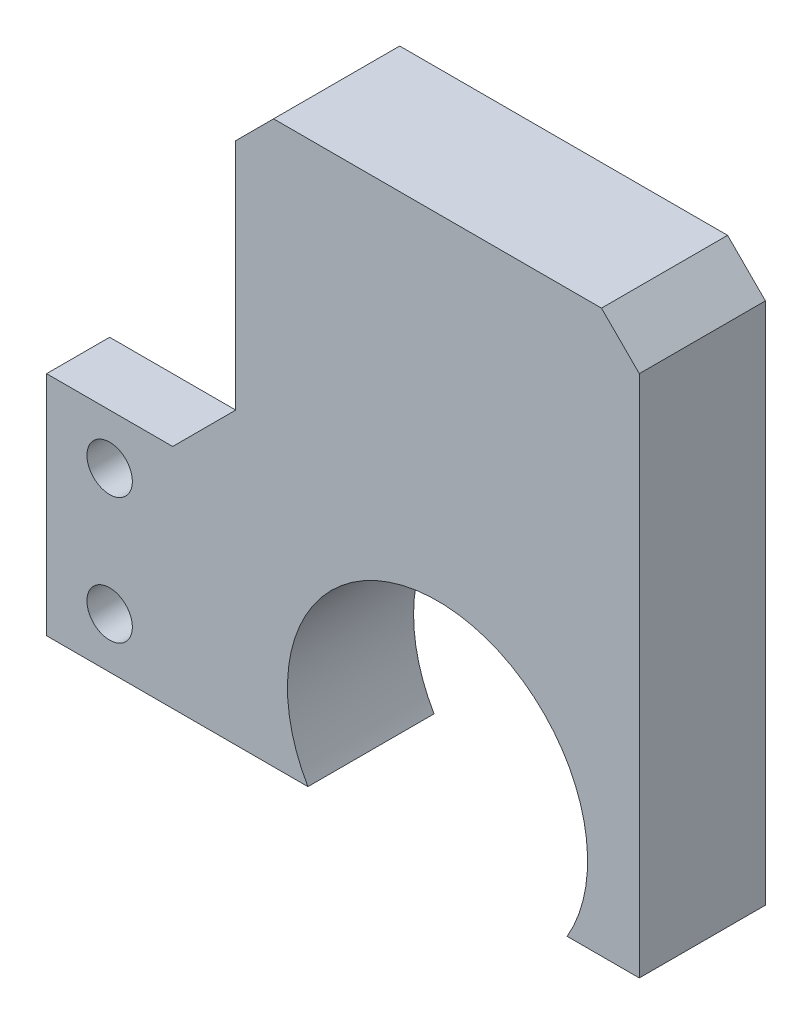
from build123d import *

# Parameters (mm, degrees)
SZKIC1_W                                          = 32
SZKIC1_H                                          = 44.5
DODANIE_WYCI_GNI_CIE1_DEPTH                       = 10
WYTNIJ_WYCI_GNI_CIE1_REACH                        = 31.173
SZKIC2_R                                          = 11.9
WYTNIJ_WYCI_GNI_CIE2_DEPTH                        = 3.4
OTW_R_3_2_3_2_1_D                                 = 3.2
OTW_R_3_2_3_2_1_DEPTH                             = 4
SZKIC7_W                                          = 15
SZKIC7_H                                          = 18
DODANIE_WYCI_GNI_CIE2_DEPTH                       = 5
SFAZOWANIE1_SIZE                                  = 5
SFAZOWANIE2_SIZE                                  = 3
POG_BIENIE_WALCOWE_POD_M3_RUB_Z_BEM_S_D           = 3.6
POG_BIENIE_WALCOWE_POD_M3_RUB_Z_BEM_S_DEPTH       = 24
POG_BIENIE_WALCOWE_POD_M3_RUB_Z_BEM_S_CBORE_D     = 7
POG_BIENIE_WALCOWE_POD_M3_RUB_Z_BEM_S_CBORE_DEPTH = 2.4
POG_BIENIE_WALCOWE_POD_M3_RUB_Z_BEM_S_TIP         = 1.081549114


with BuildPart() as part:
    # Szkic1 → Dodanie-wyciągnięcie1 (new body)
    with BuildSketch(Plane.XY):
        Rectangle(SZKIC1_W, SZKIC1_H)
    extrude(amount=DODANIE_WYCI_GNI_CIE1_DEPTH)

    # Szkic2 → Wytnij-wyciągnięcie1 (cut, up to next)
    with BuildSketch(Plane.XY.offset(10), mode=Mode.PRIVATE) as wytnij_wyci_gni_cie1_sk1:
        with Locations((0, -16.25)):
            Circle(SZKIC2_R)
    wytnij_wyci_gni_cie1_tool1 = extrude(wytnij_wyci_gni_cie1_sk1.sketch, amount=-WYTNIJ_WYCI_GNI_CIE1_REACH, mode=Mode.PRIVATE) & part.part
    add(wytnij_wyci_gni_cie1_tool1.solids().sort_by_distance((0, -16.25, 10))[0], mode=Mode.SUBTRACT)

    # Szkic3 → Wytnij-wyciągnięcie2 (cut)
    with BuildSketch(Plane.XY):
        with BuildLine():
            Line((10.2, -7.3), (10.2, 15.212957385))
            ThreePointArc((10.2, 15.212957385), (9.34039504, 15.618745241), (8.879309367, 16.45))
            Line((8.879309367, 16.45), (-8.879309367, 16.45))
            ThreePointArc((-8.879309367, 16.45), (-9.34039504, 15.618745241), (-10.2, 15.212957385))
            Line((-10.2, 15.212957385), (-10.2, -7.3))
            Line((-10.2, -7.3), (-10.2, -10.120562832))
            Line((-10.2, -10.120562832), (10.2, -10.120562832))
            Line((10.2, -10.120562832), (10.2, -7.3))
        make_face()
    extrude(amount=WYTNIJ_WYCI_GNI_CIE2_DEPTH, mode=Mode.SUBTRACT)

    # Otwór Ø3.2 (3.2)1
    with Locations(Plane(origin=(0, 0, 0), x_dir=(-1, 0, 0), z_dir=(0, 0, -1))):
        with Locations((8, 19.75), (13.5, 14.5), (13.5, 6.5), (13.5, -1.5), (13.5, -9.5), (-13.5, -9.5), (-13.5, -1.5), (-13.5, 6.5), (-13.5, 14.5), (-8, 19.75)):
            Hole(OTW_R_3_2_3_2_1_D / 2, depth=OTW_R_3_2_3_2_1_DEPTH)

    # Szkic7 → Dodanie-wyciągnięcie2 (add)
    with BuildSketch(Plane.XY.offset(10)):
        with Locations((-23.5, -13.25)):
            Rectangle(SZKIC7_W, SZKIC7_H)
    extrude(amount=-DODANIE_WYCI_GNI_CIE2_DEPTH)

    # Sfazowanie1
    sfazowanie1_edges = [part.edges().sort_by_distance(p)[0] for p in [
        (-16, -13.25, 5),
        (-16, -4.25, 7.5),
    ]]
    chamfer(sfazowanie1_edges, length=SFAZOWANIE1_SIZE - 0.0001)  # a hair under: the kernel refuses the full size

    # Sfazowanie2
    sfazowanie2_edges = [part.edges().sort_by_distance(p)[0] for p in [
        (-16, 22.25, 5),
        (16, 22.25, 5),
    ]]
    chamfer(sfazowanie2_edges, length=SFAZOWANIE2_SIZE)

    # Pogłębienie walcowe pod M3 Śrubę z łbem stożkowym ściętym1
    with Locations(Plane(origin=(0, 0, 5), x_dir=(-1, 0, 0), z_dir=(0, 0, -1))):
        with Locations((26, -18.25), (26, -8.25)):
            CounterBoreHole(POG_BIENIE_WALCOWE_POD_M3_RUB_Z_BEM_S_D / 2, POG_BIENIE_WALCOWE_POD_M3_RUB_Z_BEM_S_CBORE_D / 2, POG_BIENIE_WALCOWE_POD_M3_RUB_Z_BEM_S_CBORE_DEPTH, depth=POG_BIENIE_WALCOWE_POD_M3_RUB_Z_BEM_S_DEPTH)
            with Locations((0, 0, -(POG_BIENIE_WALCOWE_POD_M3_RUB_Z_BEM_S_DEPTH + POG_BIENIE_WALCOWE_POD_M3_RUB_Z_BEM_S_TIP / 2))):  # 118° drill point
                Cone(0, POG_BIENIE_WALCOWE_POD_M3_RUB_Z_BEM_S_D / 2, POG_BIENIE_WALCOWE_POD_M3_RUB_Z_BEM_S_TIP, mode=Mode.SUBTRACT)


solid = part.part
